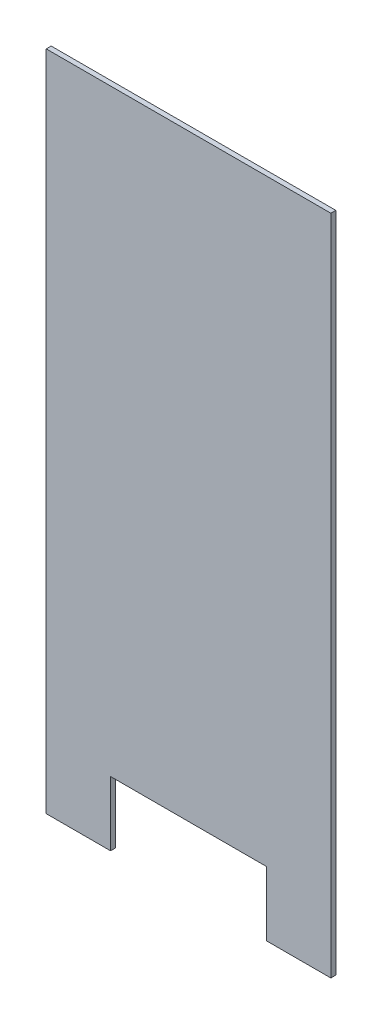
from build123d import *

# Parameters (mm, degrees)
BOSS_EXTRUDE1_DEPTH = 10


with BuildPart() as part:
    # Sketch1 → Boss-Extrude1 (new body)
    with BuildSketch(Plane.XY):
        Polygon((-287.5, 669), (287.5, 669), (287.5, -669), (157.5, -669), (157.5, -539), (-157.5, -539), (-157.5, -669), (-287.5, -669), align=None)
    extrude(amount=BOSS_EXTRUDE1_DEPTH)


solid = part.part
